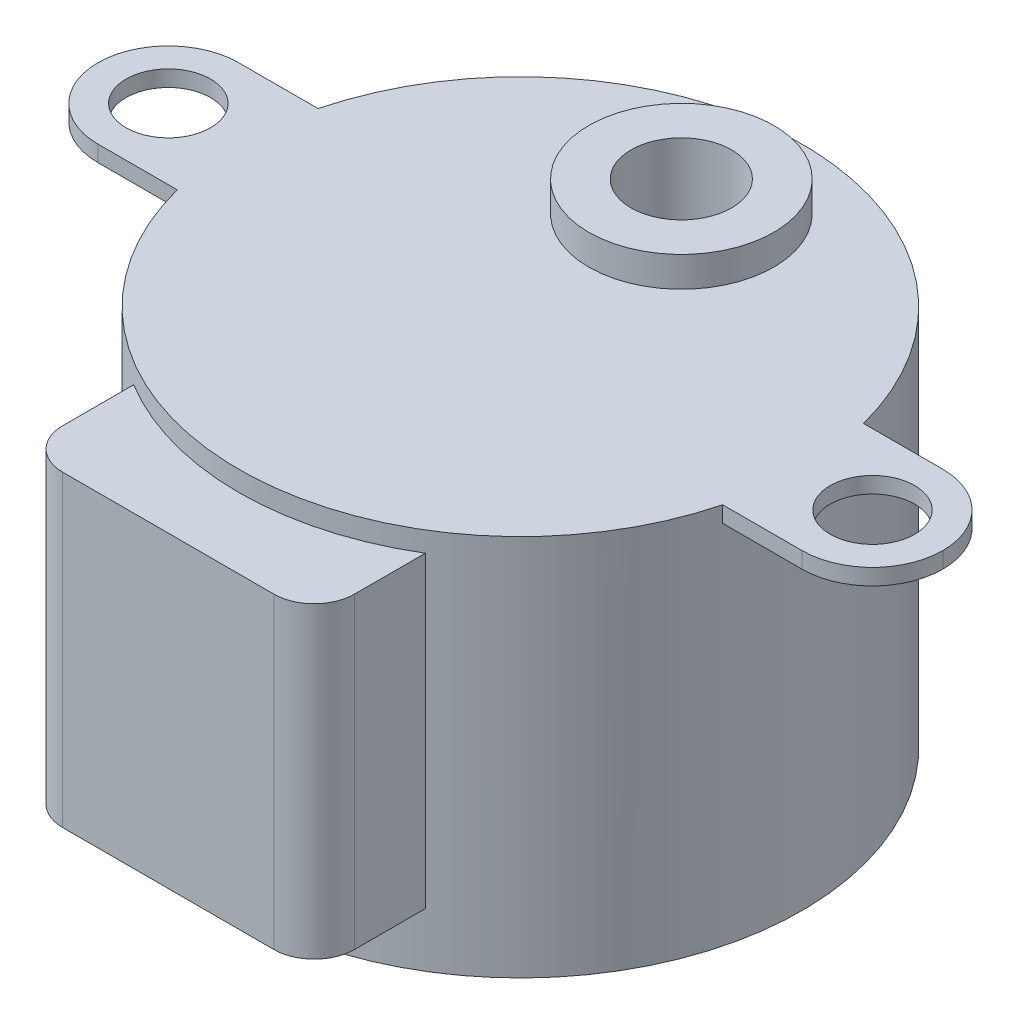
from build123d import *

# Parameters (mm, degrees)
ESQUISSE1_R             = 14
BOSS_EXTRU_1_DEPTH      = 19
ESQUISSE2_W             = 42
ESQUISSE2_H             = 7
ESQUISSE2_R             = 2.1
BOSS_EXTRU_2_DEPTH      = 0.8
CONG_1_R                = 3.5
ESQUISSE3_W             = 14.5
ESQUISSE3_H             = 8
BOSS_EXTRU_3_DEPTH      = 16.3
CONG_2_R                = 2
ESQUISSE4_R             = 4.6
BOSS_EXTRU_4_DEPTH      = 1.5
ESQUISSE5_R             = 2.5
BOSS_EXTRU_5_DEPTH      = 8.5
ESQUISSE6_W             = 12.644639
ESQUISSE6_H             = 4.455106
ESQUISSE6_W_2           = 15.068741
ESQUISSE6_H_2           = 4.782687
ENL_V_MAT_EXTRU_1_DEPTH = 6
ENL_V_START             = -1
ENL_V_MAT_EXTRU_2_DEPTH = 1
ENL_V_START_2           = -18.5
ESQUISSE8_R             = 2.5
ENL_V_MAT_EXTRU_3_DEPTH = 18.5


with BuildPart() as part:
    # Esquisse1 → Boss.-Extru.1 (new body)
    with BuildSketch(Plane(origin=(0, 0, 0), x_dir=(1, 0, 0), z_dir=(0, 1, 0))):
        with Locations(Location((0, 0, 0), (0, 0, 270))):
            Circle(ESQUISSE1_R)
    extrude(amount=BOSS_EXTRU_1_DEPTH)

    # Esquisse2 → Boss.-Extru.2 (add)
    with BuildSketch(Plane(origin=(0, 19, 0), x_dir=(1, 0, 0), z_dir=(0, 1, 0))):
        Rectangle(ESQUISSE2_W, ESQUISSE2_H)
        with Locations(Location((-17.5, 0, 0), (0, 0, 270))):
            Circle(ESQUISSE2_R, mode=Mode.SUBTRACT)
        with Locations(Location((17.5, 0, 0), (0, 0, 270))):
            Circle(ESQUISSE2_R, mode=Mode.SUBTRACT)
    extrude(amount=-BOSS_EXTRU_2_DEPTH)

    # Congé1
    cong_1_edges = [part.edges().sort_by_distance(p)[0] for p in [
        (21, 18.6, 3.5),
        (21, 18.6, -3.5),
        (-21, 18.6, 3.5),
        (-21, 18.6, -3.5),
    ]]
    fillet(cong_1_edges, radius=CONG_1_R - 0.0001)  # a hair under: the kernel refuses the full size

    # Esquisse3 → Boss.-Extru.3 (add)
    with BuildSketch(Plane(origin=(0, 19, 0), x_dir=(1, 0, 0), z_dir=(0, 1, 0))):
        with Locations((0, -13.5)):
            Rectangle(ESQUISSE3_W, ESQUISSE3_H)
    extrude(amount=-BOSS_EXTRU_3_DEPTH)

    # Congé2
    cong_2_edges = [part.edges().sort_by_distance(p)[0] for p in [
        (-7.25, 10.85, 17.5),
        (7.25, 10.85, 17.5),
    ]]
    fillet(cong_2_edges, radius=CONG_2_R)

    # Esquisse4 → Boss.-Extru.4 (add)
    with BuildSketch(Plane(origin=(0, 19, 0), x_dir=(1, 0, 0), z_dir=(0, 1, 0))):
        with Locations(Location((0, 8, 0), (0, 0, 270))):
            Circle(ESQUISSE4_R)
    extrude(amount=BOSS_EXTRU_4_DEPTH)

    # Esquisse5 → Boss.-Extru.5 (add)
    with BuildSketch(Plane(origin=(0, 20.5, 0), x_dir=(1, 0, 0), z_dir=(0, 1, 0))):
        with Locations(Location((0, 8, 0), (0, 0, 270))):
            Circle(ESQUISSE5_R)
    extrude(amount=BOSS_EXTRU_5_DEPTH)

    # Esquisse6 → Enlèv. mat.-Extru.1 (cut)
    with BuildSketch(Plane(origin=(0, 29, 0), x_dir=(1, 0, 0), z_dir=(0, 1, 0))):
        with Locations((0.098275, 11.727553)):
            Rectangle(ESQUISSE6_W, ESQUISSE6_H)
        with Locations((0.065517, 4.108657)):
            Rectangle(ESQUISSE6_W_2, ESQUISSE6_H_2)
    extrude(amount=-ENL_V_MAT_EXTRU_1_DEPTH, mode=Mode.SUBTRACT)

    # Esquisse7 → Enlèv. mat.-Extru.2 (cut)
    with BuildSketch(Plane(origin=(0, 19, 0), x_dir=(1, 0, 0), z_dir=(0, 1, 0)).offset(ENL_V_START)):
        with BuildLine():
            Line((-7.25, -11.97654), (-7.25, -22.169225))
            Line((-7.25, -22.169225), (7.25, -22.169225))
            Line((7.25, -22.169225), (7.25, -11.97654))
            ThreePointArc((7.25, -11.97654), (0, -14), (-7.25, -11.97654))
        make_face()
    extrude(amount=ENL_V_MAT_EXTRU_2_DEPTH, mode=Mode.SUBTRACT)

    # Esquisse8 → Enlèv. mat.-Extru.3 (cut)
    with BuildSketch(Plane(origin=(0, 29, 0), x_dir=(1, 0, 0), z_dir=(0, 1, 0)).offset(ENL_V_START_2)):
        with Locations(Location((0, 8, 0), (0, 0, 270))):
            Circle(ESQUISSE8_R)
    extrude(amount=ENL_V_MAT_EXTRU_3_DEPTH, mode=Mode.SUBTRACT)


solid = part.part
